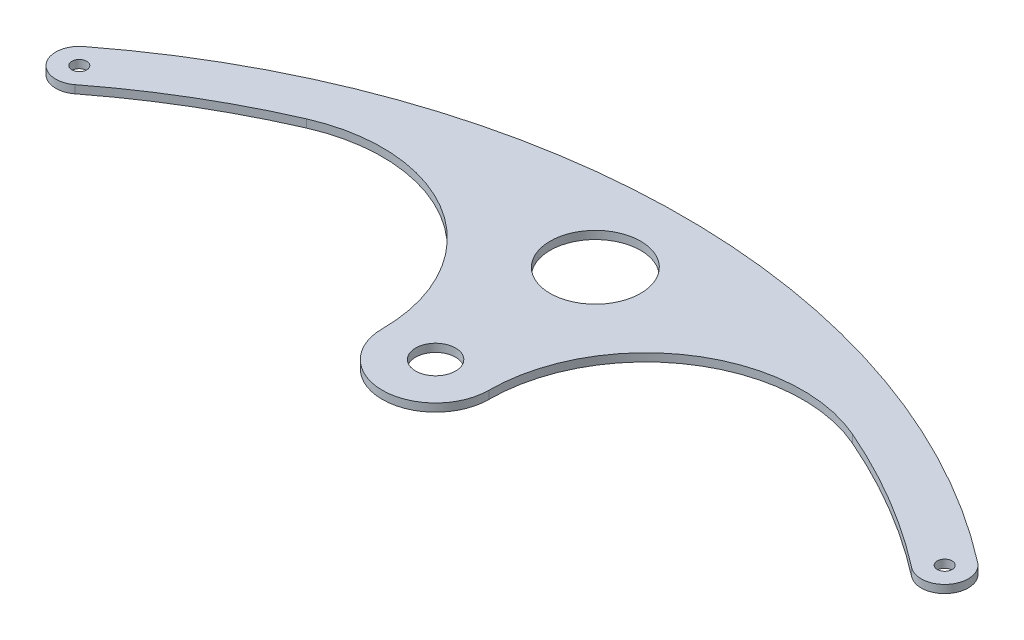
from build123d import *

# Parameters (mm, degrees)
SKETCH1_R           = 1.778
SKETCH1_R_2         = 4.7625
SKETCH1_R_3         = 10.795
BOSS_EXTRUDE1_DEPTH = 1.905


with BuildPart() as part:
    # Sketch1 → Boss-Extrude1 (new body)
    with BuildSketch(Plane(origin=(0, 0, 0), x_dir=(1, 0, 0), z_dir=(0, 1, 0))):
        with BuildLine():
            ThreePointArc((-3.434964073, 4.439030494), (-4.439030494, -3.434964073), (3.434964073, -4.439030494))
            ThreePointArc((3.434964073, -4.439030494), (20.136115591, 6.903606124), (38.111342378, 16.094639222))
            ThreePointArc((38.111342378, 16.094639222), (73.570878275, 13.084704733), (90.4875, -18.2245))
            ThreePointArc((90.4875, -18.2245), (103.1875, -30.9245), (115.8875, -18.2245))
            ThreePointArc((115.8875, -18.2245), (132.804121725, 13.084704733), (168.263657622, 16.094639222))
            ThreePointArc((168.263657622, 16.094639222), (186.238884409, 6.903606124), (202.940035927, -4.439030494))
            ThreePointArc((202.940035927, -4.439030494), (210.814030494, -3.434964073), (209.809964073, 4.439030494))
            ThreePointArc((209.809964073, 4.439030494), (103.1875, 40.874472361), (-3.434964073, 4.439030494))
        make_face()
        Circle(SKETCH1_R, mode=Mode.SUBTRACT)
        with Locations((206.375, 0)):
            Circle(SKETCH1_R, mode=Mode.SUBTRACT)
        with Locations((103.1875, -18.2245)):
            Circle(SKETCH1_R_2, mode=Mode.SUBTRACT)
        with Locations((103.1875, 19.8755)):
            Circle(SKETCH1_R_3, mode=Mode.SUBTRACT)
    extrude(amount=BOSS_EXTRUDE1_DEPTH)


solid = part.part
